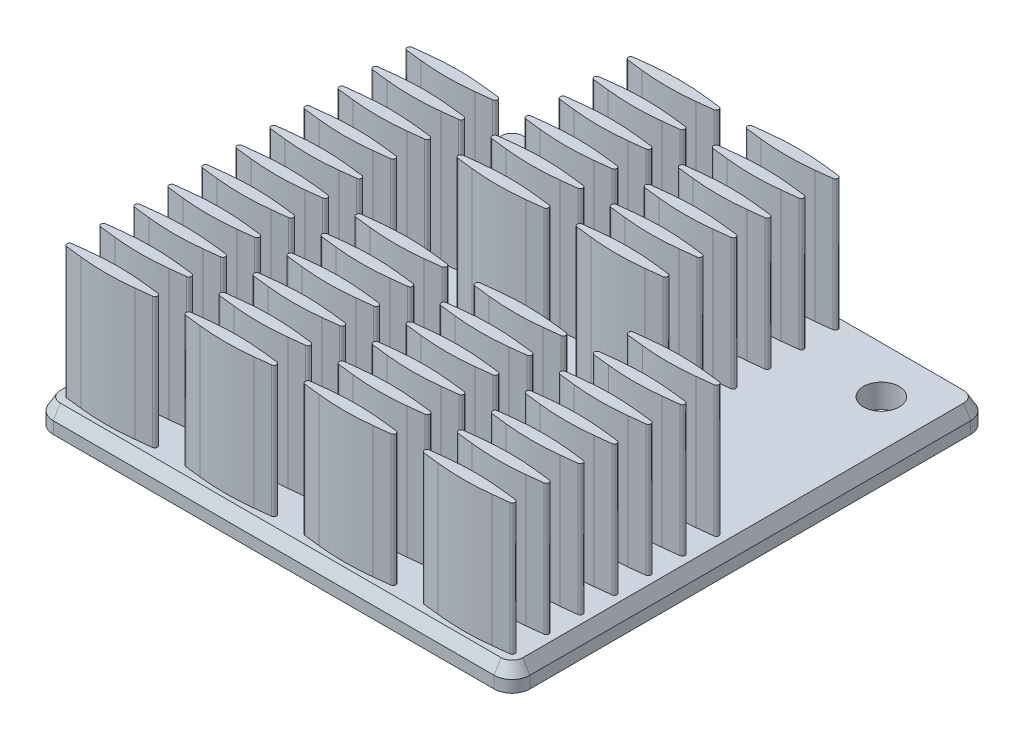
from build123d import *

# Parameters (mm, degrees)
SKETCH51_W               = 40
SKETCH51_H               = 40
BOSS_EXTRUDE44_DEPTH     = 2
BOSS_EXTRUDE45_DEPTH     = 11
BOSS_EXTRUDE46_DEPTH     = 11
BOSS_EXTRUDE47_DEPTH     = 11
BOSS_EXTRUDE48_DEPTH     = 11
BOSS_EXTRUDE49_DEPTH     = 11
BOSS_EXTRUDE50_DEPTH     = 11
BOSS_EXTRUDE51_DEPTH     = 11
BOSS_EXTRUDE52_DEPTH     = 11
BOSS_EXTRUDE53_DEPTH     = 11
BOSS_EXTRUDE54_DEPTH     = 11
BOSS_EXTRUDE55_DEPTH     = 11
BOSS_EXTRUDE56_DEPTH     = 11
BOSS_EXTRUDE57_DEPTH     = 11
BOSS_EXTRUDE58_DEPTH     = 11
BOSS_EXTRUDE59_DEPTH     = 11
BOSS_EXTRUDE60_DEPTH     = 11
BOSS_EXTRUDE61_DEPTH     = 11
BOSS_EXTRUDE62_DEPTH     = 11
BOSS_EXTRUDE63_DEPTH     = 11
BOSS_EXTRUDE64_DEPTH     = 11
BOSS_EXTRUDE65_DEPTH     = 11
BOSS_EXTRUDE66_DEPTH     = 11
BOSS_EXTRUDE67_DEPTH     = 11
BOSS_EXTRUDE68_DEPTH     = 11
BOSS_EXTRUDE69_DEPTH     = 11
BOSS_EXTRUDE70_DEPTH     = 11
BOSS_EXTRUDE71_DEPTH     = 11
BOSS_EXTRUDE72_DEPTH     = 11
BOSS_EXTRUDE73_DEPTH     = 11
BOSS_EXTRUDE74_DEPTH     = 11
BOSS_EXTRUDE75_DEPTH     = 11
BOSS_EXTRUDE76_DEPTH     = 11
BOSS_EXTRUDE77_DEPTH     = 11
BOSS_EXTRUDE78_DEPTH     = 11
BOSS_EXTRUDE79_DEPTH     = 11
BOSS_EXTRUDE80_DEPTH     = 11
BOSS_EXTRUDE81_DEPTH     = 11
BOSS_EXTRUDE82_DEPTH     = 11
BOSS_EXTRUDE83_DEPTH     = 11
BOSS_EXTRUDE84_DEPTH     = 11
BOSS_EXTRUDE85_DEPTH     = 11
BOSS_EXTRUDE86_DEPTH     = 11
F_6_0_6_DIAMETER_HOLE2_D = 6
F_3_0_3_DIAMETER_HOLE2_D = 3
FILLET3_R                = 1.5
CHAMFER2_SIZE            = 0.577350269
CHAMFER2_SIZE2           = 1
FILLET4_R                = 20


with BuildPart() as part:
    # Sketch51 → Boss-Extrude44 (new body)
    with BuildSketch(Plane(origin=(0, -39.834845013, 0), x_dir=(1, 0, 0), z_dir=(0, 1, 0))):
        with Locations((-305.582225161, -876.426699138)):
            Rectangle(SKETCH51_W, SKETCH51_H)
    extrude(amount=-BOSS_EXTRUDE44_DEPTH)

    # Sketch52 → Boss-Extrude45 (add)
    with BuildSketch(Plane(origin=(0, -39.834845013, 0), x_dir=(-1, 0, 0), z_dir=(0, 1, 0))):
        with BuildLine():
            Line((296.977307278, 858.088283444), (300.582225161, 858.499232071))
            Line((300.582225161, 858.499232071), (304.187143044, 858.088283444))
            ThreePointArc((304.187143044, 858.088283444), (304.382225161, 857.869699138), (304.187143044, 857.651114831))
            Line((304.187143044, 857.651114831), (300.582225161, 857.240166204))
            Line((300.582225161, 857.240166204), (296.977307278, 857.651114831))
            ThreePointArc((296.977307278, 857.651114831), (296.782225161, 857.869699138), (296.977307278, 858.088283444))
        make_face()
    extrude(amount=BOSS_EXTRUDE45_DEPTH)

    # Sketch53 → Boss-Extrude46 (add)
    with BuildSketch(Plane(origin=(0, -39.834845013, 0), x_dir=(-1, 0, 0), z_dir=(0, 1, 0))):
        with BuildLine():
            Line((306.977307278, 858.088283444), (310.582225161, 858.499232071))
            Line((310.582225161, 858.499232071), (314.187143044, 858.088283444))
            ThreePointArc((314.187143044, 858.088283444), (314.382225161, 857.869699138), (314.187143044, 857.651114831))
            Line((314.187143044, 857.651114831), (310.582225161, 857.240166204))
            Line((310.582225161, 857.240166204), (306.977307278, 857.651114831))
            ThreePointArc((306.977307278, 857.651114831), (306.782225161, 857.869699138), (306.977307278, 858.088283444))
        make_face()
    extrude(amount=BOSS_EXTRUDE46_DEPTH)

    # Sketch54 → Boss-Extrude47 (add)
    with BuildSketch(Plane(origin=(0, -39.834845013, 0), x_dir=(-1, 0, 0), z_dir=(0, 1, 0))):
        with BuildLine():
            Line((296.977307278, 860.943283444), (300.582225161, 861.354232071))
            Line((300.582225161, 861.354232071), (304.187143044, 860.943283444))
            ThreePointArc((304.187143044, 860.943283444), (304.382225161, 860.724699138), (304.187143044, 860.506114831))
            Line((304.187143044, 860.506114831), (300.582225161, 860.095166204))
            Line((300.582225161, 860.095166204), (296.977307278, 860.506114831))
            ThreePointArc((296.977307278, 860.506114831), (296.782225161, 860.724699138), (296.977307278, 860.943283444))
        make_face()
    extrude(amount=BOSS_EXTRUDE47_DEPTH)

    # Sketch55 → Boss-Extrude48 (add)
    with BuildSketch(Plane(origin=(0, -39.834845013, 0), x_dir=(-1, 0, 0), z_dir=(0, 1, 0))):
        with BuildLine():
            Line((306.977307278, 860.943283444), (310.582225161, 861.354232071))
            Line((310.582225161, 861.354232071), (314.187143044, 860.943283444))
            ThreePointArc((314.187143044, 860.943283444), (314.382225161, 860.724699138), (314.187143044, 860.506114831))
            Line((314.187143044, 860.506114831), (310.582225161, 860.095166204))
            Line((310.582225161, 860.095166204), (306.977307278, 860.506114831))
            ThreePointArc((306.977307278, 860.506114831), (306.782225161, 860.724699138), (306.977307278, 860.943283444))
        make_face()
    extrude(amount=BOSS_EXTRUDE48_DEPTH)

    # Sketch56 → Boss-Extrude49 (add)
    with BuildSketch(Plane(origin=(0, -39.834845013, 0), x_dir=(-1, 0, 0), z_dir=(0, 1, 0))):
        with BuildLine():
            Line((296.977307278, 863.798283444), (300.582225161, 864.209232071))
            Line((300.582225161, 864.209232071), (304.187143044, 863.798283444))
            ThreePointArc((304.187143044, 863.798283444), (304.382225161, 863.579699138), (304.187143044, 863.361114831))
            Line((304.187143044, 863.361114831), (300.582225161, 862.950166204))
            Line((300.582225161, 862.950166204), (296.977307278, 863.361114831))
            ThreePointArc((296.977307278, 863.361114831), (296.782225161, 863.579699138), (296.977307278, 863.798283444))
        make_face()
    extrude(amount=BOSS_EXTRUDE49_DEPTH)

    # Sketch57 → Boss-Extrude50 (add)
    with BuildSketch(Plane(origin=(0, -39.834845013, 0), x_dir=(-1, 0, 0), z_dir=(0, 1, 0))):
        with BuildLine():
            Line((306.977307278, 863.798283444), (310.582225161, 864.209232071))
            Line((310.582225161, 864.209232071), (314.187143044, 863.798283444))
            ThreePointArc((314.187143044, 863.798283444), (314.382225161, 863.579699138), (314.187143044, 863.361114831))
            Line((314.187143044, 863.361114831), (310.582225161, 862.950166204))
            Line((310.582225161, 862.950166204), (306.977307278, 863.361114831))
            ThreePointArc((306.977307278, 863.361114831), (306.782225161, 863.579699138), (306.977307278, 863.798283444))
        make_face()
    extrude(amount=BOSS_EXTRUDE50_DEPTH)

    # Sketch58 → Boss-Extrude51 (add)
    with BuildSketch(Plane(origin=(0, -39.834845013, 0), x_dir=(-1, 0, 0), z_dir=(0, 1, 0))):
        with BuildLine():
            Line((296.977307278, 866.653283444), (300.582225161, 867.064232071))
            Line((300.582225161, 867.064232071), (304.187143044, 866.653283444))
            ThreePointArc((304.187143044, 866.653283444), (304.382225161, 866.434699138), (304.187143044, 866.216114831))
            Line((304.187143044, 866.216114831), (300.582225161, 865.805166204))
            Line((300.582225161, 865.805166204), (296.977307278, 866.216114831))
            ThreePointArc((296.977307278, 866.216114831), (296.782225161, 866.434699138), (296.977307278, 866.653283444))
        make_face()
    extrude(amount=BOSS_EXTRUDE51_DEPTH)

    # Sketch59 → Boss-Extrude52 (add)
    with BuildSketch(Plane(origin=(0, -39.834845013, 0), x_dir=(-1, 0, 0), z_dir=(0, 1, 0))):
        with BuildLine():
            Line((306.977307278, 866.653283444), (310.582225161, 867.064232071))
            Line((310.582225161, 867.064232071), (314.187143044, 866.653283444))
            ThreePointArc((314.187143044, 866.653283444), (314.382225161, 866.434699138), (314.187143044, 866.216114831))
            Line((314.187143044, 866.216114831), (310.582225161, 865.805166204))
            Line((310.582225161, 865.805166204), (306.977307278, 866.216114831))
            ThreePointArc((306.977307278, 866.216114831), (306.782225161, 866.434699138), (306.977307278, 866.653283444))
        make_face()
    extrude(amount=BOSS_EXTRUDE52_DEPTH)

    # Sketch60 → Boss-Extrude53 (add)
    with BuildSketch(Plane(origin=(0, -39.834845013, 0), x_dir=(-1, 0, 0), z_dir=(0, 1, 0))):
        with BuildLine():
            Line((316.977307278, 866.653283444), (320.582225161, 867.064232071))
            Line((320.582225161, 867.064232071), (324.187143044, 866.653283444))
            ThreePointArc((324.187143044, 866.653283444), (324.382225161, 866.434699138), (324.187143044, 866.216114831))
            Line((324.187143044, 866.216114831), (320.582225161, 865.805166204))
            Line((320.582225161, 865.805166204), (316.977307278, 866.216114831))
            ThreePointArc((316.977307278, 866.216114831), (316.782225161, 866.434699138), (316.977307278, 866.653283444))
        make_face()
    extrude(amount=BOSS_EXTRUDE53_DEPTH)

    # Sketch61 → Boss-Extrude54 (add)
    with BuildSketch(Plane(origin=(0, -39.834845013, 0), x_dir=(-1, 0, 0), z_dir=(0, 1, 0))):
        with BuildLine():
            Line((296.977307278, 869.508283444), (300.582225161, 869.919232071))
            Line((300.582225161, 869.919232071), (304.187143044, 869.508283444))
            ThreePointArc((304.187143044, 869.508283444), (304.382225161, 869.289699138), (304.187143044, 869.071114831))
            Line((304.187143044, 869.071114831), (300.582225161, 868.660166204))
            Line((300.582225161, 868.660166204), (296.977307278, 869.071114831))
            ThreePointArc((296.977307278, 869.071114831), (296.782225161, 869.289699138), (296.977307278, 869.508283444))
        make_face()
    extrude(amount=BOSS_EXTRUDE54_DEPTH)

    # Sketch62 → Boss-Extrude55 (add)
    with BuildSketch(Plane(origin=(0, -39.834845013, 0), x_dir=(-1, 0, 0), z_dir=(0, 1, 0))):
        with BuildLine():
            Line((306.977307278, 869.508283444), (310.582225161, 869.919232071))
            Line((310.582225161, 869.919232071), (314.187143044, 869.508283444))
            ThreePointArc((314.187143044, 869.508283444), (314.382225161, 869.289699138), (314.187143044, 869.071114831))
            Line((314.187143044, 869.071114831), (310.582225161, 868.660166204))
            Line((310.582225161, 868.660166204), (306.977307278, 869.071114831))
            ThreePointArc((306.977307278, 869.071114831), (306.782225161, 869.289699138), (306.977307278, 869.508283444))
        make_face()
    extrude(amount=BOSS_EXTRUDE55_DEPTH)

    # Sketch63 → Boss-Extrude56 (add)
    with BuildSketch(Plane(origin=(0, -39.834845013, 0), x_dir=(-1, 0, 0), z_dir=(0, 1, 0))):
        with BuildLine():
            Line((316.977307278, 869.508283444), (320.582225161, 869.919232071))
            Line((320.582225161, 869.919232071), (324.187143044, 869.508283444))
            ThreePointArc((324.187143044, 869.508283444), (324.382225161, 869.289699138), (324.187143044, 869.071114831))
            Line((324.187143044, 869.071114831), (320.582225161, 868.660166204))
            Line((320.582225161, 868.660166204), (316.977307278, 869.071114831))
            ThreePointArc((316.977307278, 869.071114831), (316.782225161, 869.289699138), (316.977307278, 869.508283444))
        make_face()
    extrude(amount=BOSS_EXTRUDE56_DEPTH)

    # Sketch64 → Boss-Extrude57 (add)
    with BuildSketch(Plane(origin=(0, -39.834845013, 0), x_dir=(-1, 0, 0), z_dir=(0, 1, 0))):
        with BuildLine():
            Line((296.977307278, 872.363283444), (300.582225161, 872.774232071))
            Line((300.582225161, 872.774232071), (304.187143044, 872.363283444))
            ThreePointArc((304.187143044, 872.363283444), (304.382225161, 872.144699138), (304.187143044, 871.926114831))
            Line((304.187143044, 871.926114831), (300.582225161, 871.515166204))
            Line((300.582225161, 871.515166204), (296.977307278, 871.926114831))
            ThreePointArc((296.977307278, 871.926114831), (296.782225161, 872.144699138), (296.977307278, 872.363283444))
        make_face()
    extrude(amount=BOSS_EXTRUDE57_DEPTH)

    # Sketch65 → Boss-Extrude58 (add)
    with BuildSketch(Plane(origin=(0, -39.834845013, 0), x_dir=(-1, 0, 0), z_dir=(0, 1, 0))):
        with BuildLine():
            Line((306.977307278, 872.363283444), (310.582225161, 872.774232071))
            Line((310.582225161, 872.774232071), (314.187143044, 872.363283444))
            ThreePointArc((314.187143044, 872.363283444), (314.382225161, 872.144699138), (314.187143044, 871.926114831))
            Line((314.187143044, 871.926114831), (310.582225161, 871.515166204))
            Line((310.582225161, 871.515166204), (306.977307278, 871.926114831))
            ThreePointArc((306.977307278, 871.926114831), (306.782225161, 872.144699138), (306.977307278, 872.363283444))
        make_face()
    extrude(amount=BOSS_EXTRUDE58_DEPTH)

    # Sketch66 → Boss-Extrude59 (add)
    with BuildSketch(Plane(origin=(0, -39.834845013, 0), x_dir=(-1, 0, 0), z_dir=(0, 1, 0))):
        with BuildLine():
            Line((316.977307278, 872.363283444), (320.582225161, 872.774232071))
            Line((320.582225161, 872.774232071), (324.187143044, 872.363283444))
            ThreePointArc((324.187143044, 872.363283444), (324.382225161, 872.144699138), (324.187143044, 871.926114831))
            Line((324.187143044, 871.926114831), (320.582225161, 871.515166204))
            Line((320.582225161, 871.515166204), (316.977307278, 871.926114831))
            ThreePointArc((316.977307278, 871.926114831), (316.782225161, 872.144699138), (316.977307278, 872.363283444))
        make_face()
    extrude(amount=BOSS_EXTRUDE59_DEPTH)

    # Sketch67 → Boss-Extrude60 (add)
    with BuildSketch(Plane(origin=(0, -39.834845013, 0), x_dir=(-1, 0, 0), z_dir=(0, 1, 0))):
        with BuildLine():
            Line((316.977307278, 875.218283444), (320.582225161, 875.629232071))
            Line((320.582225161, 875.629232071), (324.187143044, 875.218283444))
            ThreePointArc((324.187143044, 875.218283444), (324.382225161, 874.999699138), (324.187143044, 874.781114831))
            Line((324.187143044, 874.781114831), (320.582225161, 874.370166204))
            Line((320.582225161, 874.370166204), (316.977307278, 874.781114831))
            ThreePointArc((316.977307278, 874.781114831), (316.782225161, 874.999699138), (316.977307278, 875.218283444))
        make_face()
    extrude(amount=BOSS_EXTRUDE60_DEPTH)

    # Sketch68 → Boss-Extrude61 (add)
    with BuildSketch(Plane(origin=(0, -39.834845013, 0), x_dir=(-1, 0, 0), z_dir=(0, 1, 0))):
        with BuildLine():
            Line((286.977307278, 878.073283444), (290.582225161, 878.484232071))
            Line((290.582225161, 878.484232071), (294.187143044, 878.073283444))
            ThreePointArc((294.187143044, 878.073283444), (294.382225161, 877.854699138), (294.187143044, 877.636114831))
            Line((294.187143044, 877.636114831), (290.582225161, 877.225166204))
            Line((290.582225161, 877.225166204), (286.977307278, 877.636114831))
            ThreePointArc((286.977307278, 877.636114831), (286.782225161, 877.854699138), (286.977307278, 878.073283444))
        make_face()
    extrude(amount=BOSS_EXTRUDE61_DEPTH)

    # Sketch69 → Boss-Extrude62 (add)
    with BuildSketch(Plane(origin=(0, -39.834845013, 0), x_dir=(-1, 0, 0), z_dir=(0, 1, 0))):
        with BuildLine():
            Line((316.977307278, 878.073283444), (320.582225161, 878.484232071))
            Line((320.582225161, 878.484232071), (324.187143044, 878.073283444))
            ThreePointArc((324.187143044, 878.073283444), (324.382225161, 877.854699138), (324.187143044, 877.636114831))
            Line((324.187143044, 877.636114831), (320.582225161, 877.225166204))
            Line((320.582225161, 877.225166204), (316.977307278, 877.636114831))
            ThreePointArc((316.977307278, 877.636114831), (316.782225161, 877.854699138), (316.977307278, 878.073283444))
        make_face()
    extrude(amount=BOSS_EXTRUDE62_DEPTH)

    # Sketch70 → Boss-Extrude63 (add)
    with BuildSketch(Plane(origin=(0, -39.834845013, 0), x_dir=(-1, 0, 0), z_dir=(0, 1, 0))):
        with BuildLine():
            Line((286.977307278, 880.928283444), (290.582225161, 881.339232071))
            Line((290.582225161, 881.339232071), (294.187143044, 880.928283444))
            ThreePointArc((294.187143044, 880.928283444), (294.382225161, 880.709699138), (294.187143044, 880.491114831))
            Line((294.187143044, 880.491114831), (290.582225161, 880.080166204))
            Line((290.582225161, 880.080166204), (286.977307278, 880.491114831))
            ThreePointArc((286.977307278, 880.491114831), (286.782225161, 880.709699138), (286.977307278, 880.928283444))
        make_face()
    extrude(amount=BOSS_EXTRUDE63_DEPTH)

    # Sketch71 → Boss-Extrude64 (add)
    with BuildSketch(Plane(origin=(0, -39.834845013, 0), x_dir=(-1, 0, 0), z_dir=(0, 1, 0))):
        with BuildLine():
            Line((296.977307278, 880.928283444), (300.582225161, 881.339232071))
            Line((300.582225161, 881.339232071), (304.187143044, 880.928283444))
            ThreePointArc((304.187143044, 880.928283444), (304.382225161, 880.709699138), (304.187143044, 880.491114831))
            Line((304.187143044, 880.491114831), (300.582225161, 880.080166204))
            Line((300.582225161, 880.080166204), (296.977307278, 880.491114831))
            ThreePointArc((296.977307278, 880.491114831), (296.782225161, 880.709699138), (296.977307278, 880.928283444))
        make_face()
    extrude(amount=BOSS_EXTRUDE64_DEPTH)

    # Sketch72 → Boss-Extrude65 (add)
    with BuildSketch(Plane(origin=(0, -39.834845013, 0), x_dir=(-1, 0, 0), z_dir=(0, 1, 0))):
        with BuildLine():
            Line((306.977307278, 880.928283444), (310.582225161, 881.339232071))
            Line((310.582225161, 881.339232071), (314.187143044, 880.928283444))
            ThreePointArc((314.187143044, 880.928283444), (314.382225161, 880.709699138), (314.187143044, 880.491114831))
            Line((314.187143044, 880.491114831), (310.582225161, 880.080166204))
            Line((310.582225161, 880.080166204), (306.977307278, 880.491114831))
            ThreePointArc((306.977307278, 880.491114831), (306.782225161, 880.709699138), (306.977307278, 880.928283444))
        make_face()
    extrude(amount=BOSS_EXTRUDE65_DEPTH)

    # Sketch73 → Boss-Extrude66 (add)
    with BuildSketch(Plane(origin=(0, -39.834845013, 0), x_dir=(-1, 0, 0), z_dir=(0, 1, 0))):
        with BuildLine():
            Line((316.977307278, 880.928283444), (320.582225161, 881.339232071))
            Line((320.582225161, 881.339232071), (324.187143044, 880.928283444))
            ThreePointArc((324.187143044, 880.928283444), (324.382225161, 880.709699138), (324.187143044, 880.491114831))
            Line((324.187143044, 880.491114831), (320.582225161, 880.080166204))
            Line((320.582225161, 880.080166204), (316.977307278, 880.491114831))
            ThreePointArc((316.977307278, 880.491114831), (316.782225161, 880.709699138), (316.977307278, 880.928283444))
        make_face()
    extrude(amount=BOSS_EXTRUDE66_DEPTH)

    # Sketch74 → Boss-Extrude67 (add)
    with BuildSketch(Plane(origin=(0, -39.834845013, 0), x_dir=(-1, 0, 0), z_dir=(0, 1, 0))):
        with BuildLine():
            Line((286.977307278, 883.783283444), (290.582225161, 884.194232071))
            Line((290.582225161, 884.194232071), (294.187143044, 883.783283444))
            ThreePointArc((294.187143044, 883.783283444), (294.382225161, 883.564699138), (294.187143044, 883.346114831))
            Line((294.187143044, 883.346114831), (290.582225161, 882.935166204))
            Line((290.582225161, 882.935166204), (286.977307278, 883.346114831))
            ThreePointArc((286.977307278, 883.346114831), (286.782225161, 883.564699138), (286.977307278, 883.783283444))
        make_face()
    extrude(amount=BOSS_EXTRUDE67_DEPTH)

    # Sketch75 → Boss-Extrude68 (add)
    with BuildSketch(Plane(origin=(0, -39.834845013, 0), x_dir=(-1, 0, 0), z_dir=(0, 1, 0))):
        with BuildLine():
            Line((296.977307278, 883.783283444), (300.582225161, 884.194232071))
            Line((300.582225161, 884.194232071), (304.187143044, 883.783283444))
            ThreePointArc((304.187143044, 883.783283444), (304.382225161, 883.564699138), (304.187143044, 883.346114831))
            Line((304.187143044, 883.346114831), (300.582225161, 882.935166204))
            Line((300.582225161, 882.935166204), (296.977307278, 883.346114831))
            ThreePointArc((296.977307278, 883.346114831), (296.782225161, 883.564699138), (296.977307278, 883.783283444))
        make_face()
    extrude(amount=BOSS_EXTRUDE68_DEPTH)

    # Sketch76 → Boss-Extrude69 (add)
    with BuildSketch(Plane(origin=(0, -39.834845013, 0), x_dir=(-1, 0, 0), z_dir=(0, 1, 0))):
        with BuildLine():
            Line((306.977307278, 883.783283444), (310.582225161, 884.194232071))
            Line((310.582225161, 884.194232071), (314.187143044, 883.783283444))
            ThreePointArc((314.187143044, 883.783283444), (314.382225161, 883.564699138), (314.187143044, 883.346114831))
            Line((314.187143044, 883.346114831), (310.582225161, 882.935166204))
            Line((310.582225161, 882.935166204), (306.977307278, 883.346114831))
            ThreePointArc((306.977307278, 883.346114831), (306.782225161, 883.564699138), (306.977307278, 883.783283444))
        make_face()
    extrude(amount=BOSS_EXTRUDE69_DEPTH)

    # Sketch77 → Boss-Extrude70 (add)
    with BuildSketch(Plane(origin=(0, -39.834845013, 0), x_dir=(-1, 0, 0), z_dir=(0, 1, 0))):
        with BuildLine():
            Line((316.977307278, 883.783283444), (320.582225161, 884.194232071))
            Line((320.582225161, 884.194232071), (324.187143044, 883.783283444))
            ThreePointArc((324.187143044, 883.783283444), (324.382225161, 883.564699138), (324.187143044, 883.346114831))
            Line((324.187143044, 883.346114831), (320.582225161, 882.935166204))
            Line((320.582225161, 882.935166204), (316.977307278, 883.346114831))
            ThreePointArc((316.977307278, 883.346114831), (316.782225161, 883.564699138), (316.977307278, 883.783283444))
        make_face()
    extrude(amount=BOSS_EXTRUDE70_DEPTH)

    # Sketch78 → Boss-Extrude71 (add)
    with BuildSketch(Plane(origin=(0, -39.834845013, 0), x_dir=(-1, 0, 0), z_dir=(0, 1, 0))):
        with BuildLine():
            Line((286.977307278, 886.638283444), (290.582225161, 887.049232071))
            Line((290.582225161, 887.049232071), (294.187143044, 886.638283444))
            ThreePointArc((294.187143044, 886.638283444), (294.382225161, 886.419699138), (294.187143044, 886.201114831))
            Line((294.187143044, 886.201114831), (290.582225161, 885.790166204))
            Line((290.582225161, 885.790166204), (286.977307278, 886.201114831))
            ThreePointArc((286.977307278, 886.201114831), (286.782225161, 886.419699138), (286.977307278, 886.638283444))
        make_face()
    extrude(amount=BOSS_EXTRUDE71_DEPTH)

    # Sketch79 → Boss-Extrude72 (add)
    with BuildSketch(Plane(origin=(0, -39.834845013, 0), x_dir=(-1, 0, 0), z_dir=(0, 1, 0))):
        with BuildLine():
            Line((296.977307278, 886.638283444), (300.582225161, 887.049232071))
            Line((300.582225161, 887.049232071), (304.187143044, 886.638283444))
            ThreePointArc((304.187143044, 886.638283444), (304.382225161, 886.419699138), (304.187143044, 886.201114831))
            Line((304.187143044, 886.201114831), (300.582225161, 885.790166204))
            Line((300.582225161, 885.790166204), (296.977307278, 886.201114831))
            ThreePointArc((296.977307278, 886.201114831), (296.782225161, 886.419699138), (296.977307278, 886.638283444))
        make_face()
    extrude(amount=BOSS_EXTRUDE72_DEPTH)

    # Sketch80 → Boss-Extrude73 (add)
    with BuildSketch(Plane(origin=(0, -39.834845013, 0), x_dir=(-1, 0, 0), z_dir=(0, 1, 0))):
        with BuildLine():
            Line((306.977307278, 886.638283444), (310.582225161, 887.049232071))
            Line((310.582225161, 887.049232071), (314.187143044, 886.638283444))
            ThreePointArc((314.187143044, 886.638283444), (314.382225161, 886.419699138), (314.187143044, 886.201114831))
            Line((314.187143044, 886.201114831), (310.582225161, 885.790166204))
            Line((310.582225161, 885.790166204), (306.977307278, 886.201114831))
            ThreePointArc((306.977307278, 886.201114831), (306.782225161, 886.419699138), (306.977307278, 886.638283444))
        make_face()
    extrude(amount=BOSS_EXTRUDE73_DEPTH)

    # Sketch81 → Boss-Extrude74 (add)
    with BuildSketch(Plane(origin=(0, -39.834845013, 0), x_dir=(-1, 0, 0), z_dir=(0, 1, 0))):
        with BuildLine():
            Line((316.977307278, 886.638283444), (320.582225161, 887.049232071))
            Line((320.582225161, 887.049232071), (324.187143044, 886.638283444))
            ThreePointArc((324.187143044, 886.638283444), (324.382225161, 886.419699138), (324.187143044, 886.201114831))
            Line((324.187143044, 886.201114831), (320.582225161, 885.790166204))
            Line((320.582225161, 885.790166204), (316.977307278, 886.201114831))
            ThreePointArc((316.977307278, 886.201114831), (316.782225161, 886.419699138), (316.977307278, 886.638283444))
        make_face()
    extrude(amount=BOSS_EXTRUDE74_DEPTH)

    # Sketch82 → Boss-Extrude75 (add)
    with BuildSketch(Plane(origin=(0, -39.834845013, 0), x_dir=(-1, 0, 0), z_dir=(0, 1, 0))):
        with BuildLine():
            Line((286.977307278, 889.493283444), (290.582225161, 889.904232071))
            Line((290.582225161, 889.904232071), (294.187143044, 889.493283444))
            ThreePointArc((294.187143044, 889.493283444), (294.382225161, 889.274699138), (294.187143044, 889.056114831))
            Line((294.187143044, 889.056114831), (290.582225161, 888.645166204))
            Line((290.582225161, 888.645166204), (286.977307278, 889.056114831))
            ThreePointArc((286.977307278, 889.056114831), (286.782225161, 889.274699138), (286.977307278, 889.493283444))
        make_face()
    extrude(amount=BOSS_EXTRUDE75_DEPTH)

    # Sketch83 → Boss-Extrude76 (add)
    with BuildSketch(Plane(origin=(0, -39.834845013, 0), x_dir=(-1, 0, 0), z_dir=(0, 1, 0))):
        with BuildLine():
            Line((296.977307278, 889.493283444), (300.582225161, 889.904232071))
            Line((300.582225161, 889.904232071), (304.187143044, 889.493283444))
            ThreePointArc((304.187143044, 889.493283444), (304.382225161, 889.274699138), (304.187143044, 889.056114831))
            Line((304.187143044, 889.056114831), (300.582225161, 888.645166204))
            Line((300.582225161, 888.645166204), (296.977307278, 889.056114831))
            ThreePointArc((296.977307278, 889.056114831), (296.782225161, 889.274699138), (296.977307278, 889.493283444))
        make_face()
    extrude(amount=BOSS_EXTRUDE76_DEPTH)

    # Sketch84 → Boss-Extrude77 (add)
    with BuildSketch(Plane(origin=(0, -39.834845013, 0), x_dir=(-1, 0, 0), z_dir=(0, 1, 0))):
        with BuildLine():
            Line((306.977307278, 889.493283444), (310.582225161, 889.904232071))
            Line((310.582225161, 889.904232071), (314.187143044, 889.493283444))
            ThreePointArc((314.187143044, 889.493283444), (314.382225161, 889.274699138), (314.187143044, 889.056114831))
            Line((314.187143044, 889.056114831), (310.582225161, 888.645166204))
            Line((310.582225161, 888.645166204), (306.977307278, 889.056114831))
            ThreePointArc((306.977307278, 889.056114831), (306.782225161, 889.274699138), (306.977307278, 889.493283444))
        make_face()
    extrude(amount=BOSS_EXTRUDE77_DEPTH)

    # Sketch85 → Boss-Extrude78 (add)
    with BuildSketch(Plane(origin=(0, -39.834845013, 0), x_dir=(-1, 0, 0), z_dir=(0, 1, 0))):
        with BuildLine():
            Line((316.977307278, 889.493283444), (320.582225161, 889.904232071))
            Line((320.582225161, 889.904232071), (324.187143044, 889.493283444))
            ThreePointArc((324.187143044, 889.493283444), (324.382225161, 889.274699138), (324.187143044, 889.056114831))
            Line((324.187143044, 889.056114831), (320.582225161, 888.645166204))
            Line((320.582225161, 888.645166204), (316.977307278, 889.056114831))
            ThreePointArc((316.977307278, 889.056114831), (316.782225161, 889.274699138), (316.977307278, 889.493283444))
        make_face()
    extrude(amount=BOSS_EXTRUDE78_DEPTH)

    # Sketch86 → Boss-Extrude79 (add)
    with BuildSketch(Plane(origin=(0, -39.834845013, 0), x_dir=(-1, 0, 0), z_dir=(0, 1, 0))):
        with BuildLine():
            Line((286.977307278, 892.348283444), (290.582225161, 892.759232071))
            Line((290.582225161, 892.759232071), (294.187143044, 892.348283444))
            ThreePointArc((294.187143044, 892.348283444), (294.382225161, 892.129699138), (294.187143044, 891.911114831))
            Line((294.187143044, 891.911114831), (290.582225161, 891.500166204))
            Line((290.582225161, 891.500166204), (286.977307278, 891.911114831))
            ThreePointArc((286.977307278, 891.911114831), (286.782225161, 892.129699138), (286.977307278, 892.348283444))
        make_face()
    extrude(amount=BOSS_EXTRUDE79_DEPTH)

    # Sketch87 → Boss-Extrude80 (add)
    with BuildSketch(Plane(origin=(0, -39.834845013, 0), x_dir=(-1, 0, 0), z_dir=(0, 1, 0))):
        with BuildLine():
            Line((296.977307278, 892.348283444), (300.582225161, 892.759232071))
            Line((300.582225161, 892.759232071), (304.187143044, 892.348283444))
            ThreePointArc((304.187143044, 892.348283444), (304.382225161, 892.129699138), (304.187143044, 891.911114831))
            Line((304.187143044, 891.911114831), (300.582225161, 891.500166204))
            Line((300.582225161, 891.500166204), (296.977307278, 891.911114831))
            ThreePointArc((296.977307278, 891.911114831), (296.782225161, 892.129699138), (296.977307278, 892.348283444))
        make_face()
    extrude(amount=BOSS_EXTRUDE80_DEPTH)

    # Sketch88 → Boss-Extrude81 (add)
    with BuildSketch(Plane(origin=(0, -39.834845013, 0), x_dir=(-1, 0, 0), z_dir=(0, 1, 0))):
        with BuildLine():
            Line((306.977307278, 892.348283444), (310.582225161, 892.759232071))
            Line((310.582225161, 892.759232071), (314.187143044, 892.348283444))
            ThreePointArc((314.187143044, 892.348283444), (314.382225161, 892.129699138), (314.187143044, 891.911114831))
            Line((314.187143044, 891.911114831), (310.582225161, 891.500166204))
            Line((310.582225161, 891.500166204), (306.977307278, 891.911114831))
            ThreePointArc((306.977307278, 891.911114831), (306.782225161, 892.129699138), (306.977307278, 892.348283444))
        make_face()
    extrude(amount=BOSS_EXTRUDE81_DEPTH)

    # Sketch89 → Boss-Extrude82 (add)
    with BuildSketch(Plane(origin=(0, -39.834845013, 0), x_dir=(-1, 0, 0), z_dir=(0, 1, 0))):
        with BuildLine():
            Line((316.977307278, 892.348283444), (320.582225161, 892.759232071))
            Line((320.582225161, 892.759232071), (324.187143044, 892.348283444))
            ThreePointArc((324.187143044, 892.348283444), (324.382225161, 892.129699138), (324.187143044, 891.911114831))
            Line((324.187143044, 891.911114831), (320.582225161, 891.500166204))
            Line((320.582225161, 891.500166204), (316.977307278, 891.911114831))
            ThreePointArc((316.977307278, 891.911114831), (316.782225161, 892.129699138), (316.977307278, 892.348283444))
        make_face()
    extrude(amount=BOSS_EXTRUDE82_DEPTH)

    # Sketch90 → Boss-Extrude83 (add)
    with BuildSketch(Plane(origin=(0, -39.834845013, 0), x_dir=(-1, 0, 0), z_dir=(0, 1, 0))):
        with BuildLine():
            Line((286.977307278, 895.203283444), (290.582225161, 895.614232071))
            Line((290.582225161, 895.614232071), (294.187143044, 895.203283444))
            ThreePointArc((294.187143044, 895.203283444), (294.382225161, 894.984699138), (294.187143044, 894.766114831))
            Line((294.187143044, 894.766114831), (290.582225161, 894.355166204))
            Line((290.582225161, 894.355166204), (286.977307278, 894.766114831))
            ThreePointArc((286.977307278, 894.766114831), (286.782225161, 894.984699138), (286.977307278, 895.203283444))
        make_face()
    extrude(amount=BOSS_EXTRUDE83_DEPTH)

    # Sketch91 → Boss-Extrude84 (add)
    with BuildSketch(Plane(origin=(0, -39.834845013, 0), x_dir=(-1, 0, 0), z_dir=(0, 1, 0))):
        with BuildLine():
            Line((296.977307278, 895.203283444), (300.582225161, 895.614232071))
            Line((300.582225161, 895.614232071), (304.187143044, 895.203283444))
            ThreePointArc((304.187143044, 895.203283444), (304.382225161, 894.984699138), (304.187143044, 894.766114831))
            Line((304.187143044, 894.766114831), (300.582225161, 894.355166204))
            Line((300.582225161, 894.355166204), (296.977307278, 894.766114831))
            ThreePointArc((296.977307278, 894.766114831), (296.782225161, 894.984699138), (296.977307278, 895.203283444))
        make_face()
    extrude(amount=BOSS_EXTRUDE84_DEPTH)

    # Sketch92 → Boss-Extrude85 (add)
    with BuildSketch(Plane(origin=(0, -39.834845013, 0), x_dir=(-1, 0, 0), z_dir=(0, 1, 0))):
        with BuildLine():
            Line((306.977307278, 895.203283444), (310.582225161, 895.614232071))
            Line((310.582225161, 895.614232071), (314.187143044, 895.203283444))
            ThreePointArc((314.187143044, 895.203283444), (314.382225161, 894.984699138), (314.187143044, 894.766114831))
            Line((314.187143044, 894.766114831), (310.582225161, 894.355166204))
            Line((310.582225161, 894.355166204), (306.977307278, 894.766114831))
            ThreePointArc((306.977307278, 894.766114831), (306.782225161, 894.984699138), (306.977307278, 895.203283444))
        make_face()
    extrude(amount=BOSS_EXTRUDE85_DEPTH)

    # Sketch93 → Boss-Extrude86 (add)
    with BuildSketch(Plane(origin=(0, -39.834845013, 0), x_dir=(-1, 0, 0), z_dir=(0, 1, 0))):
        with BuildLine():
            Line((316.977307278, 895.203283444), (320.582225161, 895.614232071))
            Line((320.582225161, 895.614232071), (324.187143044, 895.203283444))
            ThreePointArc((324.187143044, 895.203283444), (324.382225161, 894.984699138), (324.187143044, 894.766114831))
            Line((324.187143044, 894.766114831), (320.582225161, 894.355166204))
            Line((320.582225161, 894.355166204), (316.977307278, 894.766114831))
            ThreePointArc((316.977307278, 894.766114831), (316.782225161, 894.984699138), (316.977307278, 895.203283444))
        make_face()
    extrude(amount=BOSS_EXTRUDE86_DEPTH)

    # Ø6.0 (6) Diameter Hole2 (through all)
    with Locations(Plane(origin=(0, -39.834845013, 0), x_dir=(1, 0, 0), z_dir=(0, 1, 0))):
        with Locations((-305.582225161, -876.426699138)):
            Hole(F_6_0_6_DIAMETER_HOLE2_D / 2)

    # Ø3.0 (3) Diameter Hole2 (through all)
    with Locations(Plane(origin=(0, -39.834845013, 0), x_dir=(1, 0, 0), z_dir=(0, 1, 0))):
        with Locations((-290.082225161, -860.926699138), (-321.082225161, -860.926699138)):
            Hole(F_3_0_3_DIAMETER_HOLE2_D / 2)

    # Fillet3
    fillet3_edges = [part.edges().sort_by_distance(p)[0] for p in [
        (-325.582225161, -40.834845013, 896.426699138),
        (-325.582225161, -40.834845013, 856.426699138),
        (-285.582225161, -40.834845013, 896.426699138),
        (-285.582225161, -40.834845013, 856.426699138),
    ]]
    fillet(fillet3_edges, radius=FILLET3_R)

    # Chamfer2
    chamfer2_edges = [part.edges().sort_by_distance(p)[0] for p in [
        (-286.021564989, -39.834845013, 856.866038966),
        (-285.582225161, -39.834845013, 876.426699138),
        (-305.582225161, -39.834845013, 856.426699138),
        (-286.021564989, -39.834845013, 895.987359309),
        (-325.142885333, -39.834845013, 856.866038966),
        (-305.582225161, -39.834845013, 896.426699138),
        (-325.582225161, -39.834845013, 876.426699138),
        (-325.142885333, -39.834845013, 895.987359309),
    ]]
    chamfer2_side = [part.faces().sort_by_distance(p)[0] for p in [
        (-325.016539736, -39.834845013, 876.426699138),
    ]]
    chamfer(chamfer2_edges, length=CHAMFER2_SIZE, length2=CHAMFER2_SIZE2, reference=chamfer2_side[0])

    # Fillet4
    fillet4_edges = [part.edges().sort_by_distance(p)[0] for p in [
        (-300.582225161, -34.334845013, 888.645166204),
        (-300.582225161, -34.334845013, 882.935166204),
        (-300.582225161, -34.334845013, 894.355166204),
        (-300.582225161, -34.334845013, 858.499232071),
        (-300.582225161, -34.334845013, 885.790166204),
        (-300.582225161, -34.334845013, 857.240166204),
        (-300.582225161, -34.334845013, 891.500166204),
        (-310.582225161, -34.334845013, 858.499232071),
        (-320.582225161, -34.334845013, 880.080166204),
        (-310.582225161, -34.334845013, 857.240166204),
        (-320.582225161, -34.334845013, 882.935166204),
        (-300.582225161, -34.334845013, 861.354232071),
        (-320.582225161, -34.334845013, 885.790166204),
        (-300.582225161, -34.334845013, 860.095166204),
        (-320.582225161, -34.334845013, 888.645166204),
        (-310.582225161, -34.334845013, 861.354232071),
        (-320.582225161, -34.334845013, 891.500166204),
        (-310.582225161, -34.334845013, 860.095166204),
        (-320.582225161, -34.334845013, 894.355166204),
        (-300.582225161, -34.334845013, 864.209232071),
        (-290.582225161, -34.334845013, 882.935166204),
        (-300.582225161, -34.334845013, 862.950166204),
        (-310.582225161, -34.334845013, 882.935166204),
        (-310.582225161, -34.334845013, 864.209232071),
        (-290.582225161, -34.334845013, 885.790166204),
        (-310.582225161, -34.334845013, 862.950166204),
        (-310.582225161, -34.334845013, 885.790166204),
        (-300.582225161, -34.334845013, 867.064232071),
        (-290.582225161, -34.334845013, 888.645166204),
        (-300.582225161, -34.334845013, 865.805166204),
        (-310.582225161, -34.334845013, 888.645166204),
        (-310.582225161, -34.334845013, 867.064232071),
        (-290.582225161, -34.334845013, 891.500166204),
        (-310.582225161, -34.334845013, 865.805166204),
        (-310.582225161, -34.334845013, 891.500166204),
        (-320.582225161, -34.334845013, 867.064232071),
        (-290.582225161, -34.334845013, 894.355166204),
        (-320.582225161, -34.334845013, 865.805166204),
        (-310.582225161, -34.334845013, 894.355166204),
        (-300.582225161, -34.334845013, 869.919232071),
        (-320.582225161, -34.334845013, 881.339232071),
        (-300.582225161, -34.334845013, 868.660166204),
        (-290.582225161, -34.334845013, 884.194232071),
        (-310.582225161, -34.334845013, 869.919232071),
        (-300.582225161, -34.334845013, 884.194232071),
        (-310.582225161, -34.334845013, 868.660166204),
        (-310.582225161, -34.334845013, 884.194232071),
        (-320.582225161, -34.334845013, 869.919232071),
        (-320.582225161, -34.334845013, 884.194232071),
        (-320.582225161, -34.334845013, 868.660166204),
        (-290.582225161, -34.334845013, 887.049232071),
        (-300.582225161, -34.334845013, 872.774232071),
        (-300.582225161, -34.334845013, 887.049232071),
        (-300.582225161, -34.334845013, 871.515166204),
        (-310.582225161, -34.334845013, 887.049232071),
        (-310.582225161, -34.334845013, 872.774232071),
        (-320.582225161, -34.334845013, 887.049232071),
        (-310.582225161, -34.334845013, 871.515166204),
        (-290.582225161, -34.334845013, 889.904232071),
        (-320.582225161, -34.334845013, 872.774232071),
        (-300.582225161, -34.334845013, 889.904232071),
        (-320.582225161, -34.334845013, 871.515166204),
        (-310.582225161, -34.334845013, 889.904232071),
        (-320.582225161, -34.334845013, 875.629232071),
        (-320.582225161, -34.334845013, 889.904232071),
        (-320.582225161, -34.334845013, 874.370166204),
        (-290.582225161, -34.334845013, 892.759232071),
        (-290.582225161, -34.334845013, 878.484232071),
        (-300.582225161, -34.334845013, 892.759232071),
        (-290.582225161, -34.334845013, 877.225166204),
        (-310.582225161, -34.334845013, 892.759232071),
        (-320.582225161, -34.334845013, 878.484232071),
        (-320.582225161, -34.334845013, 892.759232071),
        (-320.582225161, -34.334845013, 877.225166204),
        (-290.582225161, -34.334845013, 895.614232071),
        (-290.582225161, -34.334845013, 881.339232071),
        (-300.582225161, -34.334845013, 895.614232071),
        (-290.582225161, -34.334845013, 880.080166204),
        (-310.582225161, -34.334845013, 895.614232071),
        (-300.582225161, -34.334845013, 881.339232071),
        (-320.582225161, -34.334845013, 895.614232071),
        (-310.582225161, -34.334845013, 881.339232071),
        (-310.582225161, -34.334845013, 880.080166204),
        (-300.582225161, -34.334845013, 880.080166204),
    ]]
    fillet(fillet4_edges, radius=FILLET4_R)


solid = part.part
